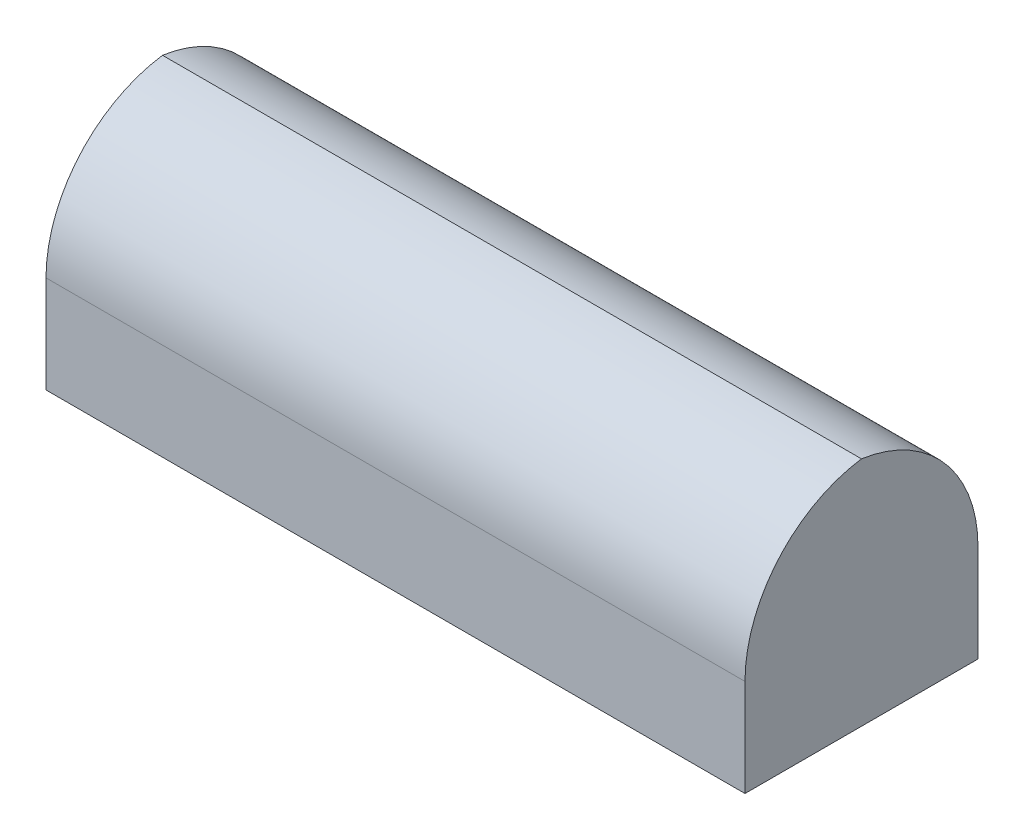
from build123d import *

# Parameters (mm, degrees)
SKETCH_1_W      = 3.6
SKETCH_1_H      = 1.2
EXTRUDE_1_DEPTH = 1.2
FILLET_1_R      = 0.7


with BuildPart() as part:
    # Эскиз1 → Бобышка-Вытянуть1 (new body)
    with BuildSketch(Plane(origin=(0, 4.85, 0), x_dir=(1, 0, 0), z_dir=(0, 1, 0))):
        with Locations((2.85, 1.95)):
            Rectangle(SKETCH_1_W, SKETCH_1_H)
    extrude(amount=EXTRUDE_1_DEPTH)

    # Скругление1
    # the kernel refuses this fillet: 0.7 mm, written as the material it takes off along each edge
    with BuildSketch(Plane(origin=(-0.7, 6.05, -1.35), x_dir=(0, -1, 0), z_dir=(1, 0, 0)), Plane(origin=(6.4, 6.05, -2.55), x_dir=(0, -1, 0), z_dir=(-1, 0, 0))) as fillet_1_piece_1:
        with BuildLine():
            CenterArc((FILLET_1_R, FILLET_1_R), FILLET_1_R, 180, 90)
            Line((0, FILLET_1_R), (0, 0))
            Line((0, 0), (FILLET_1_R, 0))
        make_face()
    extrude(amount=7.1, mode=Mode.SUBTRACT)


solid = part.part
